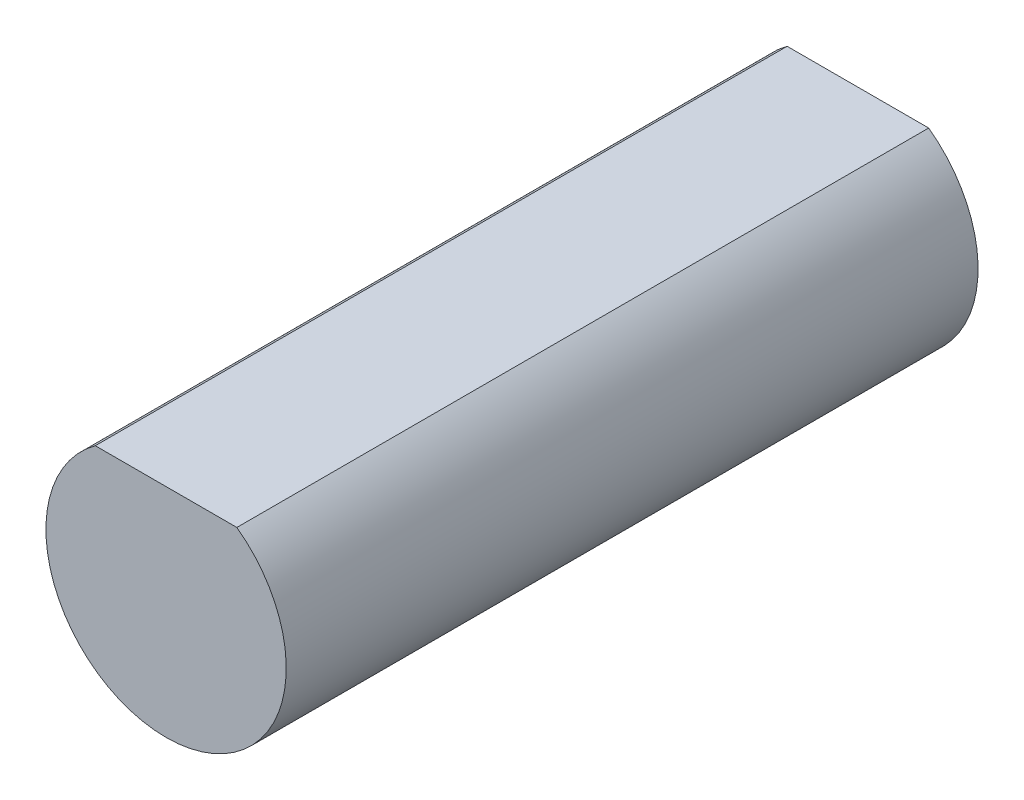
from build123d import *

# Parameters (mm, degrees)
SKETCH_1_R          = 9.9
EXTRUDE_1_DEPTH     = 57
CUT_EXTRUDE_1_DEPTH = 59.694292738


with BuildPart() as part:
    # 草图1 → 凸台-拉伸1 (new body)
    with BuildSketch(Plane.XY):
        Circle(SKETCH_1_R)
    extrude(amount=EXTRUDE_1_DEPTH)

    # 草图2 → 切除-拉伸1 (cut, through all)
    with BuildSketch(Plane.XY.offset(57)):
        with BuildLine():
            Line((-6, 8), (6, 8))
            ThreePointArc((6, 8), (0, 10), (-6, 8))
        make_face()
    extrude(amount=-CUT_EXTRUDE_1_DEPTH, mode=Mode.SUBTRACT)


solid = part.part
